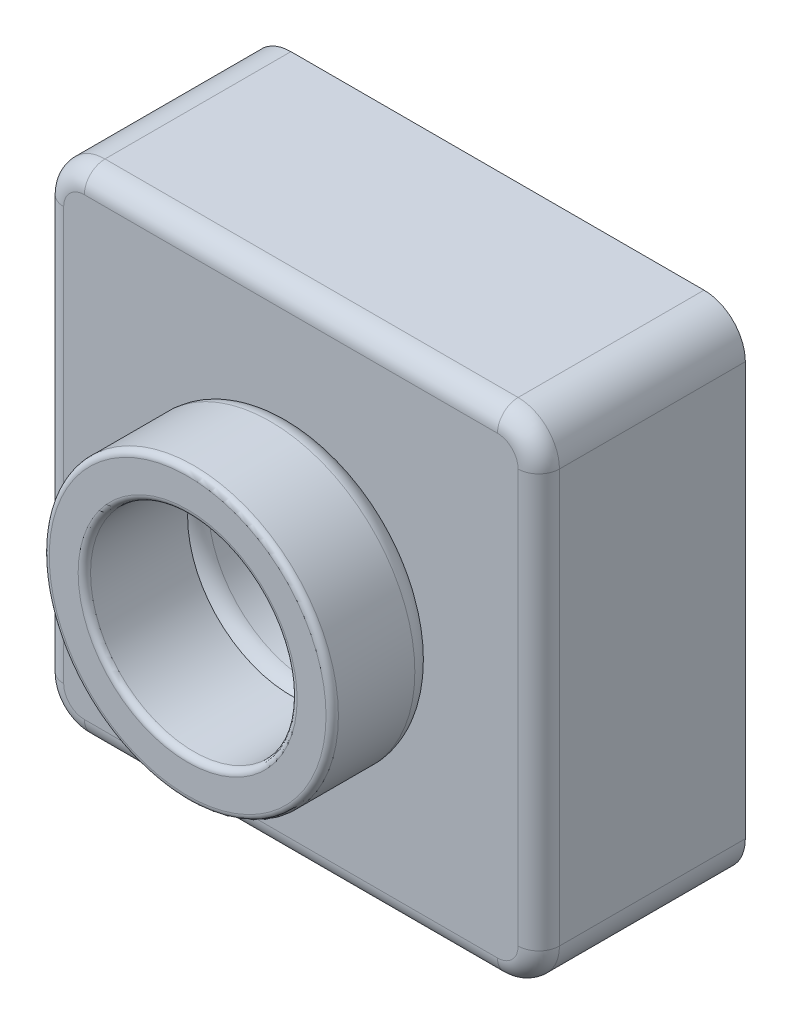
from build123d import *

# Parameters (mm, degrees)
SKETCH1_W           = 120
SKETCH1_H           = 120
BOSS_EXTRUDE1_DEPTH = 50
SKETCH2_R           = 35
BOSS_EXTRUDE2_DEPTH = 25
SKETCH3_R           = 25
CUT_EXTRUDE1_DEPTH  = 186.539753153
FILLET1_R           = 10
FILLET2_R           = 1.5
FILLET5_R           = 5
FILLET6_R           = 5
SHELL1_T            = -2


with BuildPart() as part:
    # Sketch1 → Boss-Extrude1 (new body)
    with BuildSketch(Plane.XY):
        with Locations((60, 60)):
            Rectangle(SKETCH1_W, SKETCH1_H)
    extrude(amount=BOSS_EXTRUDE1_DEPTH)


with BuildPart() as body_2:
    # Sketch2 → Boss-Extrude2 (new body)
    with BuildSketch(Plane.XY.offset(50)):
        with Locations((60, 60)):
            Circle(SKETCH2_R)
    extrude(amount=BOSS_EXTRUDE2_DEPTH)


with BuildPart() as cut_extrude1_tool:
    # Sketch3 → Cut-Extrude1 (new, through all)
    with BuildSketch(Plane.XY.offset(75)):
        with Locations((60, 60)):
            Circle(SKETCH3_R)
    extrude(amount=-CUT_EXTRUDE1_DEPTH)


with BuildPart() as part_1:
    add(part.part)

    # Cut-Extrude1: cut by cut_extrude1_tool
    add(cut_extrude1_tool.part, mode=Mode.SUBTRACT)

    # Fillet1
    fillet1_edges = [part_1.edges().sort_by_distance(p)[0] for p in [
        (0, 0, 25),
        (0, 120, 25),
        (120, 0, 25),
        (120, 120, 25),
    ]]
    fillet(fillet1_edges, radius=FILLET1_R)

    # Fillet5
    fillet5_edges = [part_1.edges().sort_by_distance(p)[0] for p in [
        (2.928932188, 117.071067812, 50),
        (60, 120, 50),
        (117.071067812, 117.071067812, 50),
        (120, 60, 50),
        (117.071067812, 2.928932188, 50),
        (60, 0, 50),
        (2.928932188, 2.928932188, 50),
        (0, 60, 50),
        (35, 60, 50),
    ]]
    fillet(fillet5_edges, radius=FILLET5_R)

    # Shell1
    shell1_openings = [part_1.faces().sort_by_distance(p)[0] for p in [
        (60, 1.697056275, 0),
    ]]
    offset(amount=SHELL1_T, openings=shell1_openings, kind=Kind.INTERSECTION)


with BuildPart() as body_2_1:
    add(body_2.part)

    # Cut-Extrude1: cut by cut_extrude1_tool
    add(cut_extrude1_tool.part, mode=Mode.SUBTRACT)

    # Fillet2
    fillet2_edges = [body_2_1.edges().sort_by_distance(p)[0] for p in [
        (25, 60, 75),
        (35, 60, 75),
    ]]
    fillet(fillet2_edges, radius=FILLET2_R)

    # Fillet6
    fillet6_edges = [body_2_1.edges().sort_by_distance(p)[0] for p in [
        (25, 60, 50),
    ]]
    fillet(fillet6_edges, radius=FILLET6_R)


solid = Compound([part_1.part, body_2_1.part])
